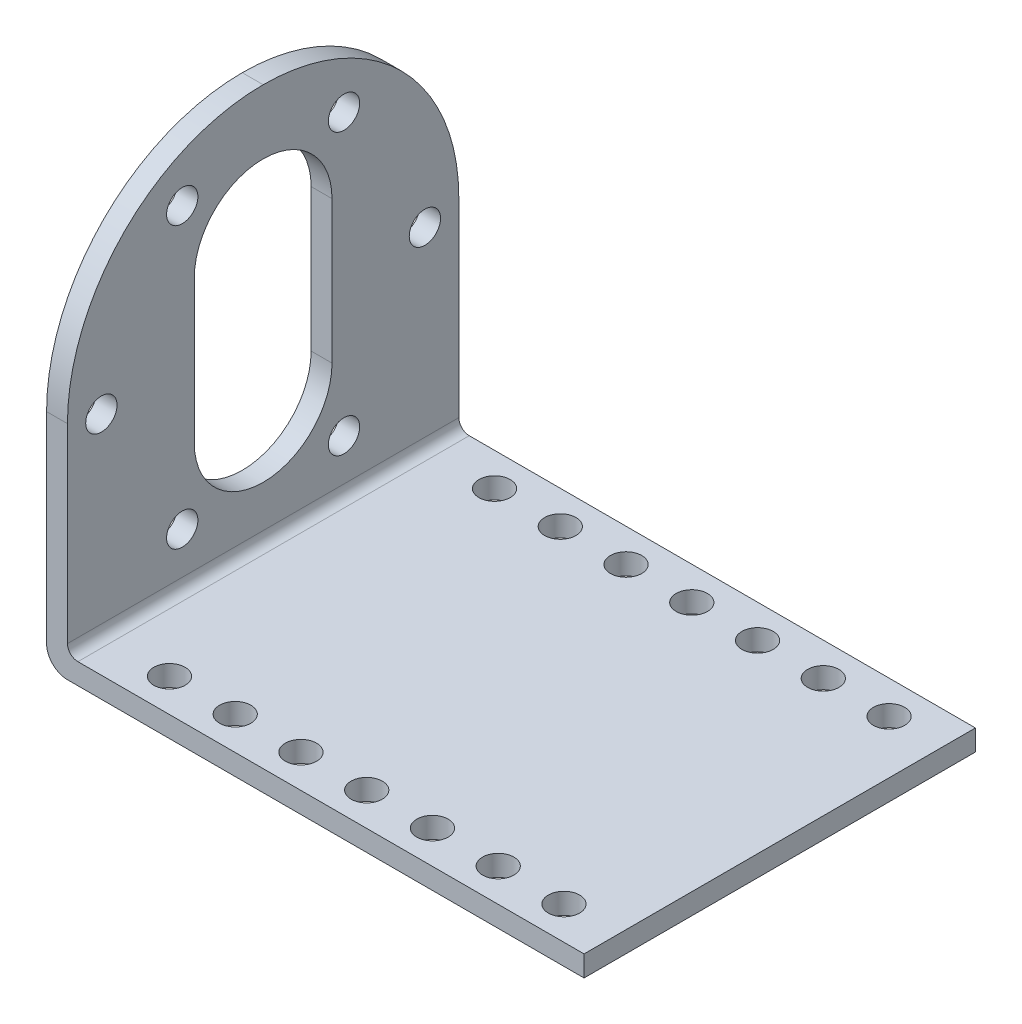
from build123d import *

# Parameters (mm, degrees)
SKETCH1_W             = 51.5
SKETCH1_H             = 37.5
BOSS_EXTRUDE1_DEPTH   = 40
SKETCH2_W             = 49.5
SKETCH2_H             = 38
CUT_EXTRUDE1_DEPTH    = 61.574850392
FILLET1_R             = 1
FILLET2_R             = 2
F_3_0MM_DOWEL_HOLE1_D = 3
CUT_EXTRUDE2_DEPTH    = 10
FILLET3_R             = 18.75
F_3_0MM_DOWEL_HOLE2_D = 3


with BuildPart() as part:
    # Sketch1 → Boss-Extrude1 (new body)
    with BuildSketch(Plane(origin=(0, 0, 0), x_dir=(1, 0, 0), z_dir=(0, 1, 0))):
        Rectangle(SKETCH1_W, SKETCH1_H)
    extrude(amount=BOSS_EXTRUDE1_DEPTH)

    # Sketch2 → Cut-Extrude1 (cut, through all)
    with BuildSketch(Plane.XY.offset(18.75)):
        with Locations((1, 21)):
            Rectangle(SKETCH2_W, SKETCH2_H)
    extrude(amount=-CUT_EXTRUDE1_DEPTH, mode=Mode.SUBTRACT)

    # Fillet1
    fillet1_edges = [part.edges().sort_by_distance(p)[0] for p in [
        (-23.75, 2, 0),
    ]]
    fillet(fillet1_edges, radius=FILLET1_R)

    # Fillet2
    fillet2_edges = [part.edges().sort_by_distance(p)[0] for p in [
        (-25.75, 0, 0),
    ]]
    fillet(fillet2_edges, radius=FILLET2_R)

    # Ø3.0mm Dowel Hole1 (through all)
    with Locations(Plane(origin=(0, 2, 0), x_dir=(1, 0, 0), z_dir=(0, 1, 0))):
        with Locations((-17.15, -15.575), (-17.15, 15.575), (-10.85, -15.575), (-4.55, -15.575), (1.75, -15.575), (8.05, -15.575), (14.35, -15.575), (20.65, -15.575), (20.65, 15.575), (14.35, 15.575), (8.05, 15.575), (1.75, 15.575), (-4.55, 15.575), (-10.85, 15.575)):
            Hole(F_3_0MM_DOWEL_HOLE1_D / 2)

    # Sketch7 → Cut-Extrude2 (cut)
    with BuildSketch(Plane.ZY.offset(25.75)):
        with BuildLine():
            Line((6.6, 27.246787517), (6.6, 13.6))
            ThreePointArc((6.6, 13.6), (0, 7), (-6.6, 13.6))
            Line((-6.6, 13.6), (-6.6, 27.246787517))
            ThreePointArc((-6.6, 27.246787517), (0, 33.846787517), (6.6, 27.246787517))
        make_face()
    extrude(amount=-CUT_EXTRUDE2_DEPTH, mode=Mode.SUBTRACT)

    # Fillet3
    fillet3_edges = [part.edges().sort_by_distance(p)[0] for p in [
        (-24.75, 40, 18.75),
        (-24.75, 40, -18.75),
    ]]
    fillet(fillet3_edges, radius=FILLET3_R - 0.0001)  # a hair under: the kernel refuses the full size

    # Ø3.0mm Dowel Hole2 (through all)
    with Locations(Plane.ZY.offset(25.75)):
        with Locations((-7.75, 33.846787517), (7.75, 33.846787517), (15.5, 20.423393759), (7.75, 7), (-7.75, 7), (-15.5, 20.423393759)):
            Hole(F_3_0MM_DOWEL_HOLE2_D / 2)


solid = part.part
